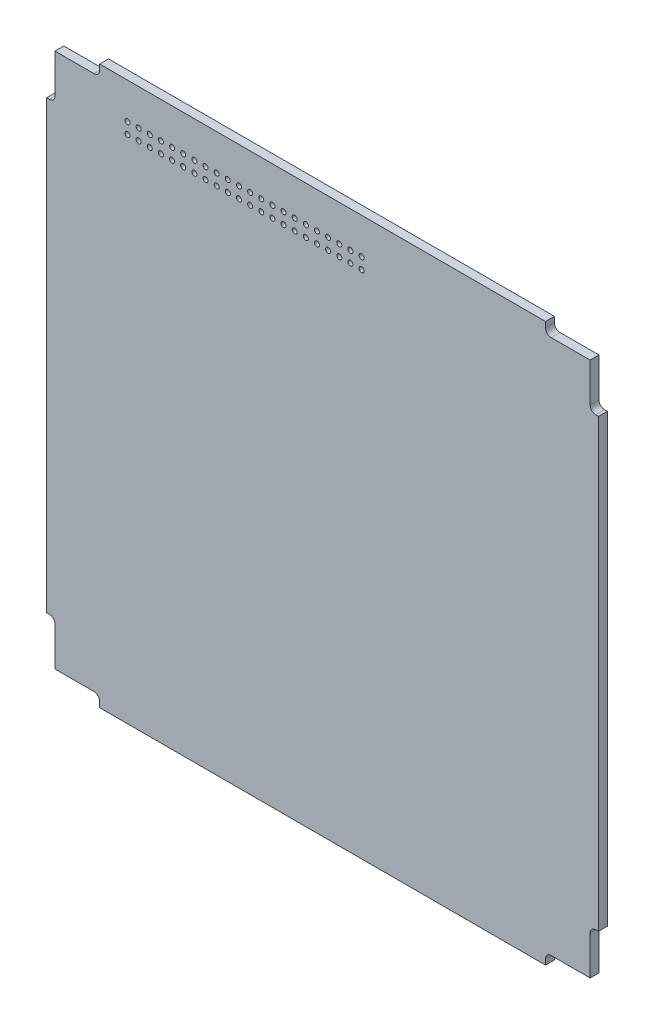
from build123d import *

# Parameters (mm, degrees)
BOSS_EXTRUDE1_DEPTH = 1.5875
FILLET1_R           = 1
SKETCH2_R           = 0.45
CUT_EXTRUDE1_DEPTH  = 71.728496069
SKETCH5_OUTSIDE_W   = 130.286
SKETCH5_OUTSIDE_H   = 130.286
SKETCH5_OUTSIDE_W_2 = 99
SKETCH5_OUTSIDE_H_2 = 100
CUT_EXTRUDE3_DEPTH  = 71.728496069


with BuildPart() as part:
    # Sketch1 → Boss-Extrude1 (new body)
    with BuildSketch(Plane.XY):
        Polygon((40, 50), (-40, 50), (-40, 48), (-48, 48), (-48, 40), (-50, 40), (-50, -37.864895224), (-50, -40), (-48, -40), (-48, -48), (-40, -48), (-40, -50), (-37.864895224, -50), (40, -50), (40, -48), (48, -48), (48, -40), (50, -40), (50, 40), (48, 40), (48, 48), (40, 48), align=None)
    extrude(amount=BOSS_EXTRUDE1_DEPTH)

    # Fillet1
    fillet1_edges = [part.edges().sort_by_distance(p)[0] for p in [
        (-48, -40, 0.79375),
        (-40, -48, 0.79375),
        (40, -48, 0.79375),
        (48, -40, 0.79375),
        (48, 40, 0.79375),
        (40, 48, 0.79375),
        (-40, 48, 0.79375),
        (-48, 40, 0.79375),
    ]]
    fillet(fillet1_edges, radius=FILLET1_R)

    # Sketch2 → Cut-Extrude1 (cut, through all)
    with BuildSketch(Plane.XY.offset(1.5875)):
        with Locations((-35, 43.55)):
            Circle(SKETCH2_R)
        with Locations((-33, 43.55)):
            Circle(SKETCH2_R)
        with Locations((-31, 43.55)):
            Circle(SKETCH2_R)
        with Locations((-29, 43.55)):
            Circle(SKETCH2_R)
        with Locations((-27, 43.55)):
            Circle(SKETCH2_R)
        with Locations((-25, 43.55)):
            Circle(SKETCH2_R)
        with Locations((-23, 43.55)):
            Circle(SKETCH2_R)
        with Locations((-21, 43.55)):
            Circle(SKETCH2_R)
        with Locations((-19, 43.55)):
            Circle(SKETCH2_R)
        with Locations((-17, 43.55)):
            Circle(SKETCH2_R)
        with Locations((-15, 43.55)):
            Circle(SKETCH2_R)
        with Locations((-13, 43.55)):
            Circle(SKETCH2_R)
        with Locations((-11, 43.55)):
            Circle(SKETCH2_R)
        with Locations((-9, 43.55)):
            Circle(SKETCH2_R)
        with Locations((-7, 43.55)):
            Circle(SKETCH2_R)
        with Locations((-5, 43.55)):
            Circle(SKETCH2_R)
        with Locations((-3, 43.55)):
            Circle(SKETCH2_R)
        with Locations((-1, 43.55)):
            Circle(SKETCH2_R)
        with Locations((1, 43.55)):
            Circle(SKETCH2_R)
        with Locations((3, 43.55)):
            Circle(SKETCH2_R)
        with Locations((5, 43.55)):
            Circle(SKETCH2_R)
        with Locations((7, 43.55)):
            Circle(SKETCH2_R)
        with Locations((-33, 41.55)):
            Circle(SKETCH2_R)
        with Locations((-31, 41.55)):
            Circle(SKETCH2_R)
        with Locations((-29, 41.55)):
            Circle(SKETCH2_R)
        with Locations((-27, 41.55)):
            Circle(SKETCH2_R)
        with Locations((-25, 41.55)):
            Circle(SKETCH2_R)
        with Locations((-23, 41.55)):
            Circle(SKETCH2_R)
        with Locations((-21, 41.55)):
            Circle(SKETCH2_R)
        with Locations((-19, 41.55)):
            Circle(SKETCH2_R)
        with Locations((-17, 41.55)):
            Circle(SKETCH2_R)
        with Locations((-15, 41.55)):
            Circle(SKETCH2_R)
        with Locations((-13, 41.55)):
            Circle(SKETCH2_R)
        with Locations((-11, 41.55)):
            Circle(SKETCH2_R)
        with Locations((-9, 41.55)):
            Circle(SKETCH2_R)
        with Locations((-7, 41.55)):
            Circle(SKETCH2_R)
        with Locations((-5, 41.55)):
            Circle(SKETCH2_R)
        with Locations((-3, 41.55)):
            Circle(SKETCH2_R)
        with Locations((-1, 41.55)):
            Circle(SKETCH2_R)
        with Locations((1, 41.55)):
            Circle(SKETCH2_R)
        with Locations((3, 41.55)):
            Circle(SKETCH2_R)
        with Locations((5, 41.55)):
            Circle(SKETCH2_R)
        with Locations((7, 41.55)):
            Circle(SKETCH2_R)
        with Locations((-35, 41.55)):
            Circle(SKETCH2_R)
    extrude(amount=-CUT_EXTRUDE1_DEPTH, mode=Mode.SUBTRACT)

    # Sketch5 outside → Cut-Extrude3 (cut, through all)
    with BuildSketch(Plane(origin=(0, 0, 0), x_dir=(-1, 0, 0), z_dir=(0, 0, -1))):
        Rectangle(SKETCH5_OUTSIDE_W, SKETCH5_OUTSIDE_H)
        Rectangle(SKETCH5_OUTSIDE_W_2, SKETCH5_OUTSIDE_H_2, mode=Mode.SUBTRACT)
    extrude(amount=-CUT_EXTRUDE3_DEPTH, mode=Mode.SUBTRACT)


solid = part.part
